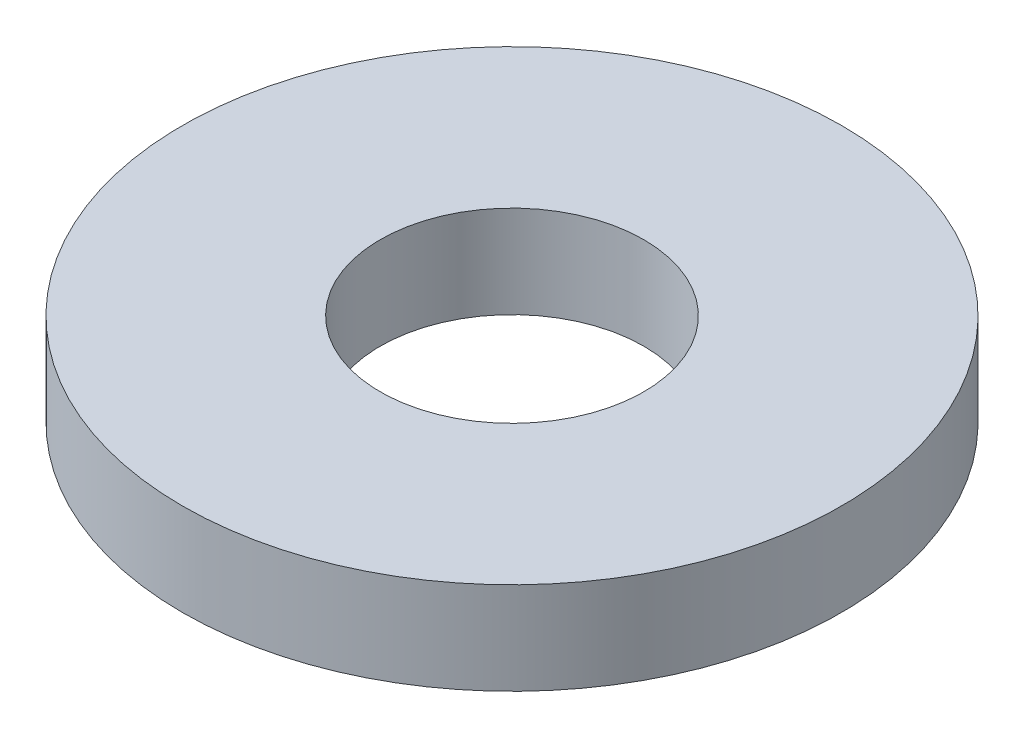
from build123d import *

# Parameters (mm, degrees)
SKETCH1_R           = 75
BOSS_EXTRUDE1_DEPTH = 21
SKETCH2_R           = 30
CUT_EXTRUDE1_DEPTH  = 109.124927746


with BuildPart() as part:
    # Sketch1 → Boss-Extrude1 (new body)
    with BuildSketch(Plane(origin=(0, 0, 0), x_dir=(1, 0, 0), z_dir=(0, 1, 0))):
        Circle(SKETCH1_R)
    extrude(amount=BOSS_EXTRUDE1_DEPTH)

    # Sketch2 → Cut-Extrude1 (cut, through all)
    with BuildSketch(Plane(origin=(0, 0, 0), x_dir=(1, 0, 0), z_dir=(0, 1, 0))):
        Circle(SKETCH2_R)
    extrude(amount=CUT_EXTRUDE1_DEPTH, mode=Mode.SUBTRACT)


solid = part.part
